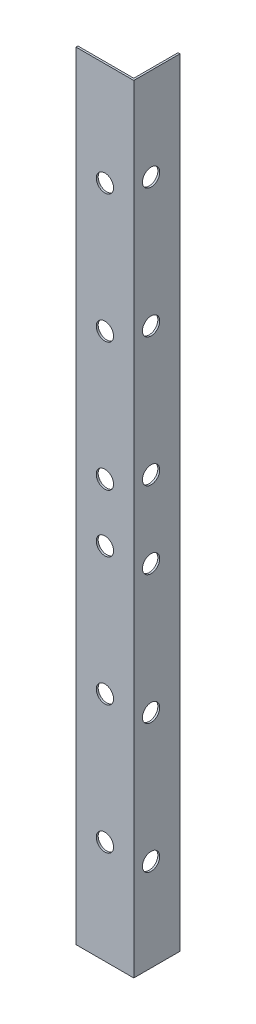
from build123d import *

# Parameters (mm, degrees)
BOSS_EXTRUDE1_DEPTH = 202
CUT_EXTRUDE1_REACH  = 204.911
SKETCH2_R           = 2.25
CUT_EXTRUDE2_REACH  = 204.911
SKETCH3_R           = 2.25


with BuildPart() as part:
    # Sketch1 → Boss-Extrude1 (new body)
    with BuildSketch(Plane(origin=(0, 0, 0), x_dir=(1, 0, 0), z_dir=(0, 1, 0))):
        Polygon((0, 0), (15, 0), (15, 12), (14.5, 12), (14.5, 0.5), (0, 0.5), align=None)
    extrude(amount=BOSS_EXTRUDE1_DEPTH)

    # Sketch2 → Cut-Extrude1 (cut, up to next)
    with BuildSketch(Plane.XY, mode=Mode.PRIVATE) as cut_extrude1_sk1:
        with Locations((7.5, 175.166666667)):
            Circle(SKETCH2_R)
    cut_extrude1_tool1 = extrude(cut_extrude1_sk1.sketch, amount=-CUT_EXTRUDE1_REACH, mode=Mode.PRIVATE) & part.part
    # Sketch2 → Cut-Extrude1 (cut, up to next)
    with BuildSketch(Plane.XY, mode=Mode.PRIVATE) as cut_extrude1_sk2:
        with Locations((7.5, 141.833333333)):
            Circle(SKETCH2_R)
    cut_extrude1_tool2 = extrude(cut_extrude1_sk2.sketch, amount=-CUT_EXTRUDE1_REACH, mode=Mode.PRIVATE) & part.part
    # Sketch2 → Cut-Extrude1 (cut, up to next)
    with BuildSketch(Plane.XY, mode=Mode.PRIVATE) as cut_extrude1_sk3:
        with Locations((7.5, 108.5)):
            Circle(SKETCH2_R)
    cut_extrude1_tool3 = extrude(cut_extrude1_sk3.sketch, amount=-CUT_EXTRUDE1_REACH, mode=Mode.PRIVATE) & part.part
    # Sketch2 → Cut-Extrude1 (cut, up to next)
    with BuildSketch(Plane.XY, mode=Mode.PRIVATE) as cut_extrude1_sk4:
        with Locations((7.5, 93.5)):
            Circle(SKETCH2_R)
    cut_extrude1_tool4 = extrude(cut_extrude1_sk4.sketch, amount=-CUT_EXTRUDE1_REACH, mode=Mode.PRIVATE) & part.part
    # Sketch2 → Cut-Extrude1 (cut, up to next)
    with BuildSketch(Plane.XY, mode=Mode.PRIVATE) as cut_extrude1_sk5:
        with Locations((7.5, 60.166666667)):
            Circle(SKETCH2_R)
    cut_extrude1_tool5 = extrude(cut_extrude1_sk5.sketch, amount=-CUT_EXTRUDE1_REACH, mode=Mode.PRIVATE) & part.part
    # Sketch2 → Cut-Extrude1 (cut, up to next)
    with BuildSketch(Plane.XY, mode=Mode.PRIVATE) as cut_extrude1_sk6:
        with Locations((7.5, 26.833333333)):
            Circle(SKETCH2_R)
    cut_extrude1_tool6 = extrude(cut_extrude1_sk6.sketch, amount=-CUT_EXTRUDE1_REACH, mode=Mode.PRIVATE) & part.part
    add(cut_extrude1_tool1.solids().sort_by_distance((7.5, 175.166667, 0))[0], mode=Mode.SUBTRACT)
    add(cut_extrude1_tool2.solids().sort_by_distance((7.5, 141.833333, 0))[0], mode=Mode.SUBTRACT)
    add(cut_extrude1_tool3.solids().sort_by_distance((7.5, 108.5, 0))[0], mode=Mode.SUBTRACT)
    add(cut_extrude1_tool4.solids().sort_by_distance((7.5, 93.5, 0))[0], mode=Mode.SUBTRACT)
    add(cut_extrude1_tool5.solids().sort_by_distance((7.5, 60.166667, 0))[0], mode=Mode.SUBTRACT)
    add(cut_extrude1_tool6.solids().sort_by_distance((7.5, 26.833333, 0))[0], mode=Mode.SUBTRACT)

    # Sketch3 → Cut-Extrude2 (cut, up to next)
    with BuildSketch(Plane(origin=(15, 0, 0), x_dir=(0, 0, -1), z_dir=(1, 0, 0)), mode=Mode.PRIVATE) as cut_extrude2_sk1:
        with Locations((4.5, 24)):
            Circle(SKETCH3_R)
    cut_extrude2_tool1 = extrude(cut_extrude2_sk1.sketch, amount=-CUT_EXTRUDE2_REACH, mode=Mode.PRIVATE) & part.part
    # Sketch3 → Cut-Extrude2 (cut, up to next)
    with BuildSketch(Plane(origin=(15, 0, 0), x_dir=(0, 0, -1), z_dir=(1, 0, 0)), mode=Mode.PRIVATE) as cut_extrude2_sk2:
        with Locations((4.5, 57.5)):
            Circle(SKETCH3_R)
    cut_extrude2_tool2 = extrude(cut_extrude2_sk2.sketch, amount=-CUT_EXTRUDE2_REACH, mode=Mode.PRIVATE) & part.part
    # Sketch3 → Cut-Extrude2 (cut, up to next)
    with BuildSketch(Plane(origin=(15, 0, 0), x_dir=(0, 0, -1), z_dir=(1, 0, 0)), mode=Mode.PRIVATE) as cut_extrude2_sk3:
        with Locations((4.5, 91)):
            Circle(SKETCH3_R)
    cut_extrude2_tool3 = extrude(cut_extrude2_sk3.sketch, amount=-CUT_EXTRUDE2_REACH, mode=Mode.PRIVATE) & part.part
    # Sketch3 → Cut-Extrude2 (cut, up to next)
    with BuildSketch(Plane(origin=(15, 0, 0), x_dir=(0, 0, -1), z_dir=(1, 0, 0)), mode=Mode.PRIVATE) as cut_extrude2_sk4:
        with Locations((4.5, 111)):
            Circle(SKETCH3_R)
    cut_extrude2_tool4 = extrude(cut_extrude2_sk4.sketch, amount=-CUT_EXTRUDE2_REACH, mode=Mode.PRIVATE) & part.part
    # Sketch3 → Cut-Extrude2 (cut, up to next)
    with BuildSketch(Plane(origin=(15, 0, 0), x_dir=(0, 0, -1), z_dir=(1, 0, 0)), mode=Mode.PRIVATE) as cut_extrude2_sk5:
        with Locations((4.5, 144.5)):
            Circle(SKETCH3_R)
    cut_extrude2_tool5 = extrude(cut_extrude2_sk5.sketch, amount=-CUT_EXTRUDE2_REACH, mode=Mode.PRIVATE) & part.part
    # Sketch3 → Cut-Extrude2 (cut, up to next)
    with BuildSketch(Plane(origin=(15, 0, 0), x_dir=(0, 0, -1), z_dir=(1, 0, 0)), mode=Mode.PRIVATE) as cut_extrude2_sk6:
        with Locations((4.5, 178)):
            Circle(SKETCH3_R)
    cut_extrude2_tool6 = extrude(cut_extrude2_sk6.sketch, amount=-CUT_EXTRUDE2_REACH, mode=Mode.PRIVATE) & part.part
    add(cut_extrude2_tool1.solids().sort_by_distance((15, 24, -4.5))[0], mode=Mode.SUBTRACT)
    add(cut_extrude2_tool2.solids().sort_by_distance((15, 57.5, -4.5))[0], mode=Mode.SUBTRACT)
    add(cut_extrude2_tool3.solids().sort_by_distance((15, 91, -4.5))[0], mode=Mode.SUBTRACT)
    add(cut_extrude2_tool4.solids().sort_by_distance((15, 111, -4.5))[0], mode=Mode.SUBTRACT)
    add(cut_extrude2_tool5.solids().sort_by_distance((15, 144.5, -4.5))[0], mode=Mode.SUBTRACT)
    add(cut_extrude2_tool6.solids().sort_by_distance((15, 178, -4.5))[0], mode=Mode.SUBTRACT)


solid = part.part
